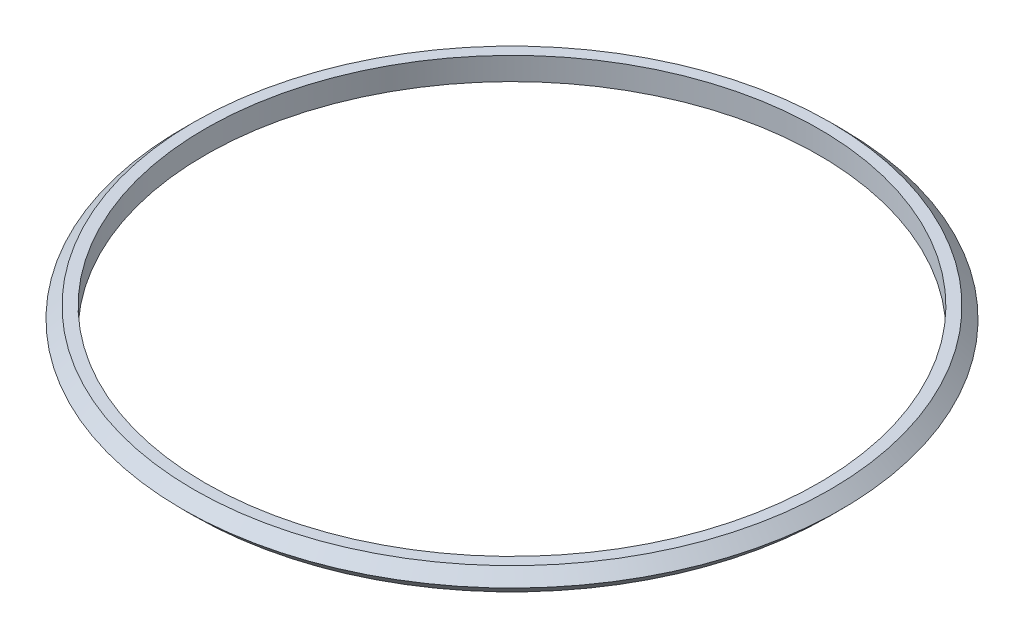
from build123d import *

# Parameters (mm, degrees)
SKETCH3_R           = 14.5
SKETCH3_R_2         = 13.5
BOSS_EXTRUDE2_DEPTH = 1
CHAMFER1_SIZE       = 0.5


with BuildPart() as part:
    # Sketch3 → Boss-Extrude2 (new body)
    with BuildSketch(Plane(origin=(0, 0, 0), x_dir=(1, 0, 0), z_dir=(0, 1, 0))):
        with Locations(Location((0, 0, 0), (0, 0, 270))):
            Circle(SKETCH3_R)
        with Locations(Location((0, 0, 0), (0, 0, 270))):
            Circle(SKETCH3_R_2, mode=Mode.SUBTRACT)
    extrude(amount=BOSS_EXTRUDE2_DEPTH)

    # Chamfer1
    # the kernel refuses this chamfer: 0.5 mm, written as the material it takes off along each edge
    with BuildSketch(Plane(origin=(0, 0, 0), x_dir=(0, 0, 1), z_dir=(-1, 0, 0))) as chamfer1_piece_1:
        Polygon((14.5, CHAMFER1_SIZE), (14.5 - CHAMFER1_SIZE, 0), (14.5, 0), align=None)
    revolve(axis=Axis((0, 0, 0), (0, 1, 0)), mode=Mode.SUBTRACT)
    with BuildSketch(Plane(origin=(0, 1, 0), x_dir=(0, 0, 1), z_dir=(-1, 0, 0))) as chamfer1_piece_2:
        Polygon((14.5, -CHAMFER1_SIZE), (14.5 - CHAMFER1_SIZE, 0), (14.5, 0), align=None)
    revolve(axis=Axis((0, 1, 0), (0, 1, 0)), mode=Mode.SUBTRACT)


solid = part.part
